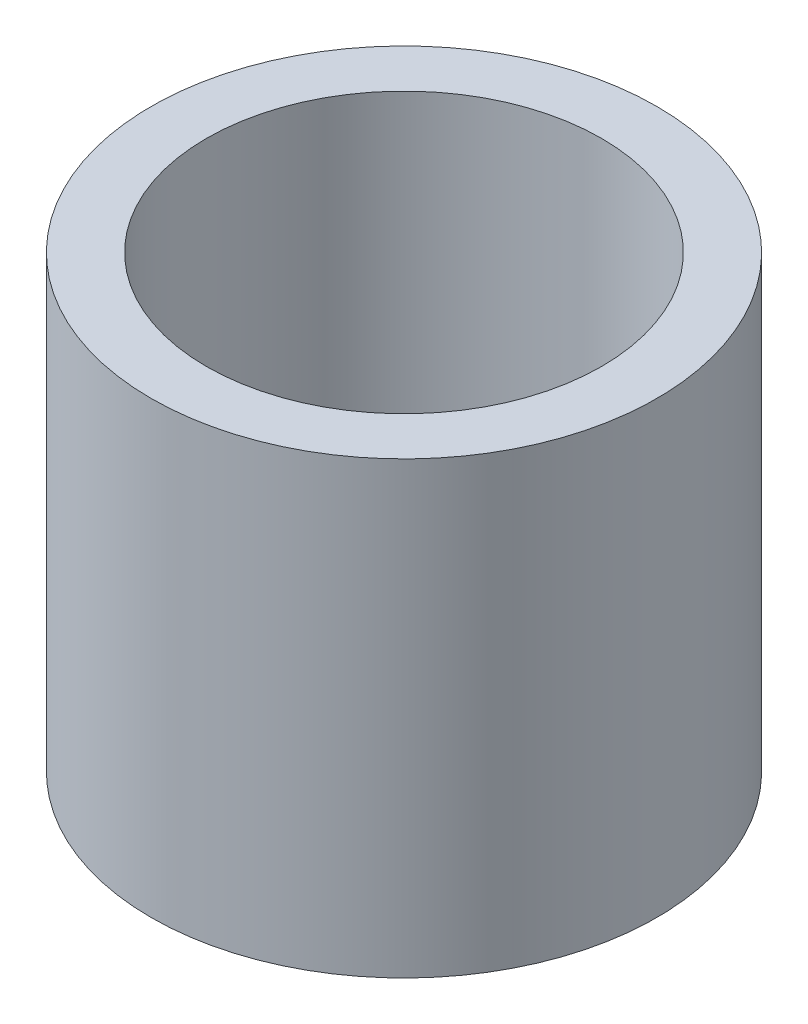
from build123d import *

# Parameters (mm, degrees)
SKETCH1_R           = 7.14375
SKETCH1_R_2         = 5.58165
BOSS_EXTRUDE1_DEPTH = 12.7


with BuildPart() as part:
    # Sketch1 → Boss-Extrude1 (new body)
    with BuildSketch(Plane(origin=(0, 0, 0), x_dir=(1, 0, 0), z_dir=(0, 1, 0))):
        Circle(SKETCH1_R)
        Circle(SKETCH1_R_2, mode=Mode.SUBTRACT)
    extrude(amount=BOSS_EXTRUDE1_DEPTH)


solid = part.part
